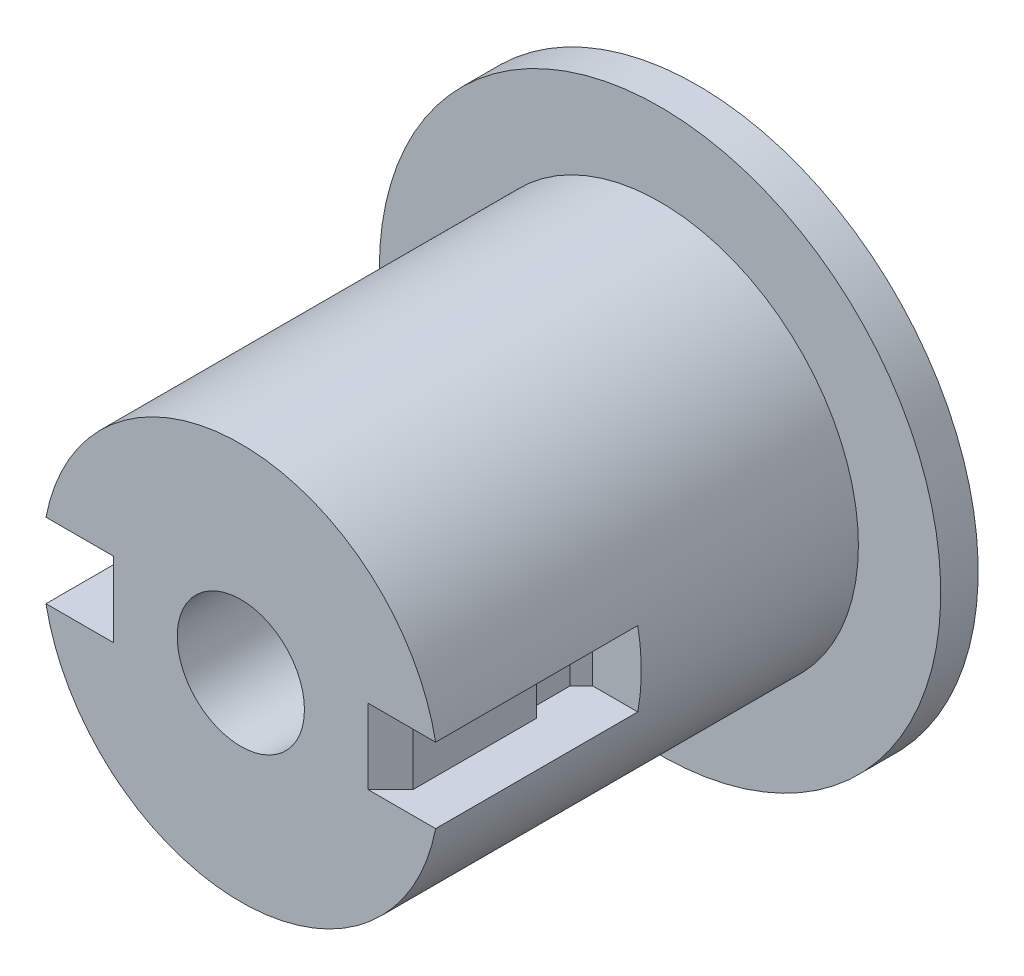
from build123d import *

# Parameters (mm, degrees)
SKETCH1_R           = 26.5
BOSS_EXTRUDE1_DEPTH = 56
SKETCH4_R           = 37.5
BOSS_EXTRUDE2_DEPTH = 5
SKETCH5_R           = 8.5
CUT_EXTRUDE1_DEPTH  = 81.830068663
CUT_EXTRUDE2_DEPTH  = 5


with BuildPart() as part:
    # Sketch1 → Boss-Extrude1 (new body)
    with BuildSketch(Plane.XY):
        Circle(SKETCH1_R)
    extrude(amount=BOSS_EXTRUDE1_DEPTH)

    # Sketch4 → Boss-Extrude2 (add)
    with BuildSketch(Plane(origin=(0, 0, 0), x_dir=(-1, 0, 0), z_dir=(0, 0, -1))):
        Circle(SKETCH4_R)
    extrude(amount=BOSS_EXTRUDE2_DEPTH)

    # Sketch5 → Cut-Extrude1 (cut, through all)
    with BuildSketch(Plane.XY.offset(56)):
        Circle(SKETCH5_R)
    extrude(amount=-CUT_EXTRUDE1_DEPTH, mode=Mode.SUBTRACT)

    # Sketch6 → Cut-Extrude2 (cut, symmetric)
    with BuildSketch(Plane(origin=(0, 0, 0), x_dir=(1, 0, 0), z_dir=(0, 1, 0))):
        Polygon((17, -56), (20, -56), (26.5, -56), (26.5, -29), (20, -29), (18.5, -30.5), (18.5, -35), (20, -36.5), (20, -53), align=None)
    cut_extrude2 = extrude(amount=CUT_EXTRUDE2_DEPTH, both=True, mode=Mode.SUBTRACT)

    # Mirror1: Cut-Extrude2 across plane
    add(cut_extrude2.mirror(Plane(origin=(0, 0, 0), x_dir=(0, 0, 1), z_dir=(1, 0, 0))), mode=Mode.SUBTRACT)


solid = part.part
